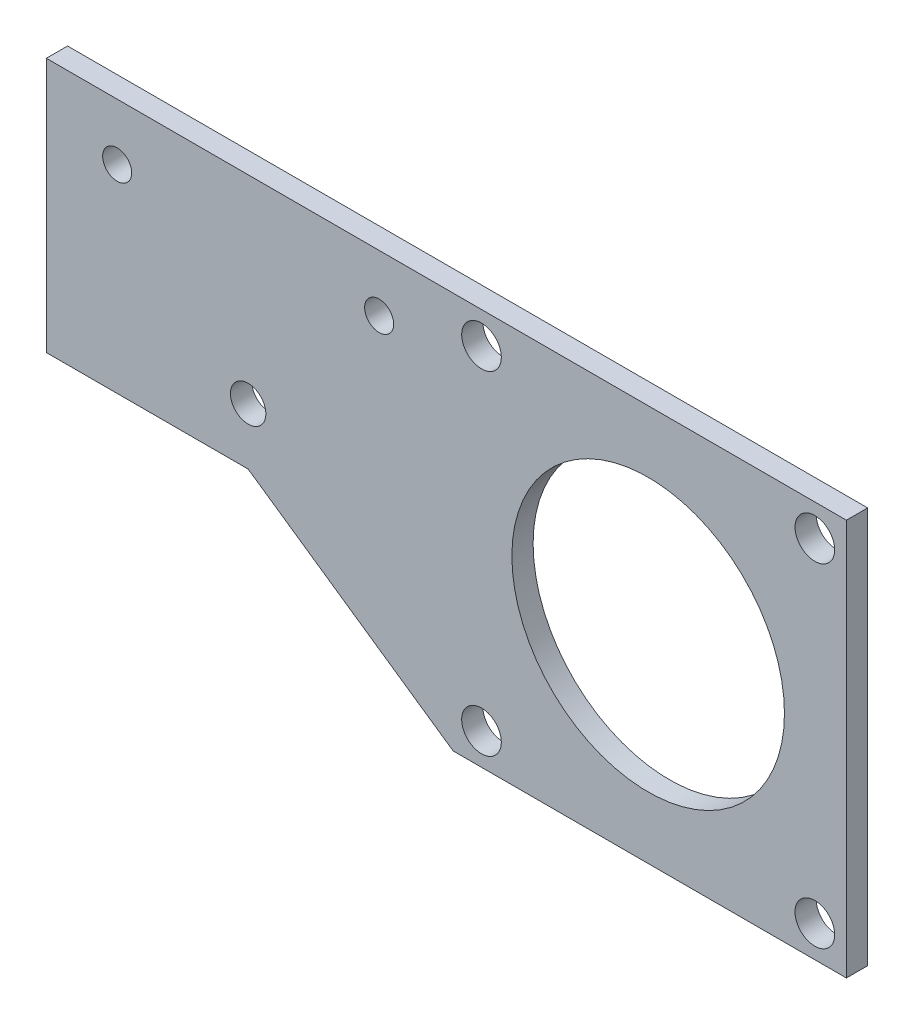
from build123d import *

# Parameters (mm, degrees)
SKETCH1_W           = 113
SKETCH1_H           = 56
SKETCH1_R           = 19.25
SKETCH1_R_2         = 2.5
SKETCH1_R_3         = 2.8
BOSS_EXTRUDE1_DEPTH = 3
CUT_EXTRUDE1_DEPTH  = 3
SKETCH3_R           = 2.05
CUT_EXTRUDE2_DEPTH  = 10


with BuildPart() as part:
    # Sketch1 → Boss-Extrude1 (new body)
    with BuildSketch(Plane.XY):
        with Locations((56.5, 28)):
            Rectangle(SKETCH1_W, SKETCH1_H)
        with Locations((85, 28)):
            Circle(SKETCH1_R, mode=Mode.SUBTRACT)
        with Locations((28.5, 28)):
            Circle(SKETCH1_R_2, mode=Mode.SUBTRACT)
        with Locations((61.46, 51.54)):
            Circle(SKETCH1_R_3, mode=Mode.SUBTRACT)
        with Locations((61.46, 4.46)):
            Circle(SKETCH1_R_3, mode=Mode.SUBTRACT)
        with Locations((108.54, 4.46)):
            Circle(SKETCH1_R_3, mode=Mode.SUBTRACT)
        with Locations((108.54, 51.54)):
            Circle(SKETCH1_R_3, mode=Mode.SUBTRACT)
    extrude(amount=BOSS_EXTRUDE1_DEPTH)

    # Sketch2 → Cut-Extrude1 (cut)
    with BuildSketch(Plane.XY.offset(3)):
        Polygon((57.46, 0), (28.5, 20), (0, 20), (0, 28), (-30.035464335, 6.528850882), (11.479915888, -13.732243772), align=None)
    extrude(amount=-CUT_EXTRUDE1_DEPTH, mode=Mode.SUBTRACT)

    # Sketch3 → Cut-Extrude2 (cut)
    with BuildSketch(Plane(origin=(0, 0, 0), x_dir=(-1, 0, 0), z_dir=(0, 0, -1))):
        with Locations((-47.001204436, 47.999419281)):
            Circle(SKETCH3_R)
        with Locations((-10.001204503, 48.001647488)):
            Circle(SKETCH3_R)
    extrude(amount=-CUT_EXTRUDE2_DEPTH, mode=Mode.SUBTRACT)


solid = part.part
